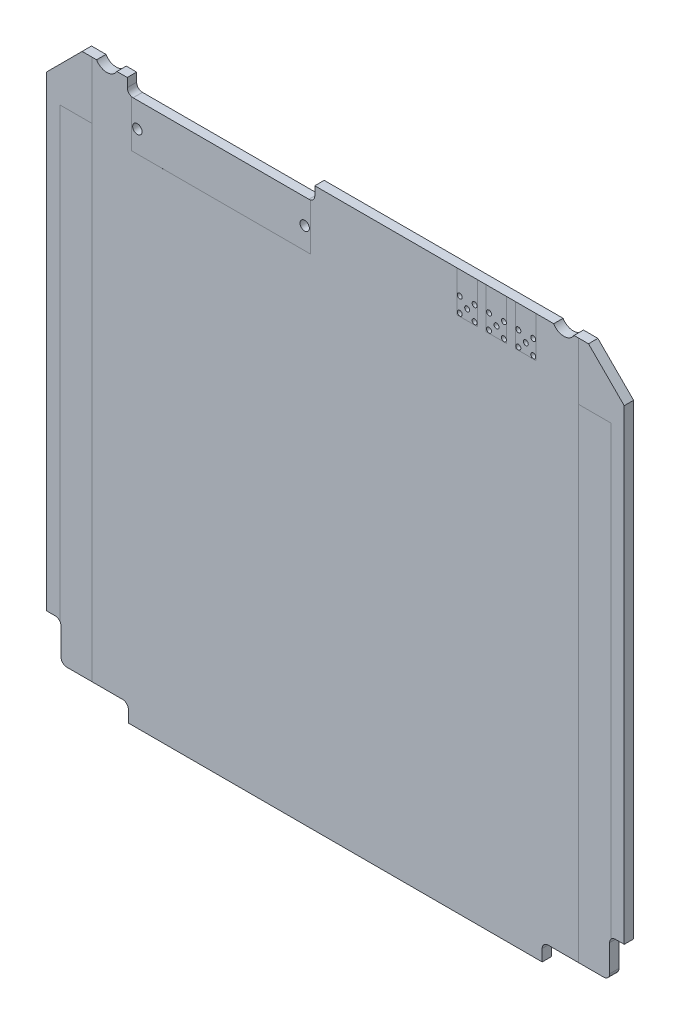
from build123d import *

# Parameters (mm, degrees)
SKETCH1_R               = 0.425
SKETCH1_R_2             = 0.8
BOSS_EXTRUDE1_DEPTH     = 1.6
KEEPOUT_TOP_DEPTH       = 0.0001
KEEPOUT_BOTTOM_DEPTH    = 0.0001
PARTFOOTPRINTS_W        = 30.48
PARTFOOTPRINTS_H        = 7.989227112
PARTFOOTPRINTS_W_2      = 3.5
PARTFOOTPRINTS_H_2      = 6.95
FOOTPRINTS_DEPTH        = 0.0001
CAUTION_TOP_START       = -0.00015
CAUTION_TOP_DEPTH       = 0.00015
CUT_EXTRUDE2_DEPTH      = 71.235674696
CUT_EXTRUDE2_DEPTH_BACK = 71.235674696


with BuildPart() as part:
    # Sketch1 → Boss-Extrude1 (new body)
    with BuildSketch(Plane(origin=(0, 0, -0.0125), x_dir=(-1, 0, 0), z_dir=(0, 0, -1))):
        with BuildLine():
            Line((35.3, -50), (35.3, -48))
            ThreePointArc((35.3, -48), (35.592893219, -47.292893219), (36.3, -47))
            Line((36.3, -47), (45.8, -47))
            ThreePointArc((45.8, -47), (46.507106781, -46.707106781), (46.8, -46))
            Line((46.8, -46), (46.8, -41.4))
            ThreePointArc((46.8, -41.4), (47.092893219, -40.692893219), (47.8, -40.4))
            Line((47.8, -40.4), (49.3, -40.4))
            Line((49.3, -40.4), (49.3, 39.2))
            Line((49.3, 39.2), (43.2, 45.3))
            Line((43.2, 45.3), (35.500000002, 45.3))
            Line((35.500000002, 45.3), (35.500000002, 43.8))
            ThreePointArc((35.500000002, 43.8), (35.207106783, 43.092893219), (34.500000002, 42.8))
            Line((34.500000002, 42.8), (4.499999998, 42.8))
            ThreePointArc((4.499999998, 42.8), (3.792893217, 43.092893219), (3.499999998, 43.8))
            Line((3.499999998, 43.8), (3.499999998, 45.3))
            Line((3.499999998, 45.3), (-43.2, 45.3))
            Line((-43.2, 45.3), (-49.3, 39.2))
            Line((-49.3, 39.2), (-49.3, -40.4))
            Line((-49.3, -40.4), (-47.8, -40.4))
            ThreePointArc((-47.8, -40.4), (-47.092893219, -40.692893219), (-46.8, -41.4))
            Line((-46.8, -41.4), (-46.8, -46))
            ThreePointArc((-46.8, -46), (-46.507106781, -46.707106781), (-45.8, -47))
            Line((-45.8, -47), (-36.3, -47))
            ThreePointArc((-36.3, -47), (-35.592893219, -47.292893219), (-35.3, -48))
            Line((-35.3, -48), (-35.3, -50))
            Line((-35.3, -50), (35.3, -50))
        make_face()
        with Locations((-26.23, 41.37)):
            Circle(SKETCH1_R, mode=Mode.SUBTRACT)
        with Locations((-28.77, 41.37)):
            Circle(SKETCH1_R, mode=Mode.SUBTRACT)
        with Locations((-27.5, 40.1)):
            Circle(SKETCH1_R, mode=Mode.SUBTRACT)
        with Locations((-21.23, 41.37)):
            Circle(SKETCH1_R, mode=Mode.SUBTRACT)
        with Locations((-28.77, 38.83)):
            Circle(SKETCH1_R, mode=Mode.SUBTRACT)
        with Locations((-23.77, 41.37)):
            Circle(SKETCH1_R, mode=Mode.SUBTRACT)
        with Locations((-22.5, 40.1)):
            Circle(SKETCH1_R, mode=Mode.SUBTRACT)
        with Locations((-26.23, 38.83)):
            Circle(SKETCH1_R, mode=Mode.SUBTRACT)
        with Locations((-31.23, 41.37)):
            Circle(SKETCH1_R, mode=Mode.SUBTRACT)
        with Locations((-33.77, 41.37)):
            Circle(SKETCH1_R, mode=Mode.SUBTRACT)
        with Locations((-23.77, 38.83)):
            Circle(SKETCH1_R, mode=Mode.SUBTRACT)
        with Locations((-32.5, 40.1)):
            Circle(SKETCH1_R, mode=Mode.SUBTRACT)
        with Locations((-33.77, 38.83)):
            Circle(SKETCH1_R, mode=Mode.SUBTRACT)
        with Locations((-31.23, 38.83)):
            Circle(SKETCH1_R, mode=Mode.SUBTRACT)
        with Locations((33.775, 38.54)):
            Circle(SKETCH1_R_2, mode=Mode.SUBTRACT)
        with Locations((5.225, 38.54)):
            Circle(SKETCH1_R_2, mode=Mode.SUBTRACT)
        with Locations((-21.23, 38.83)):
            Circle(SKETCH1_R, mode=Mode.SUBTRACT)
    extrude(amount=-BOSS_EXTRUDE1_DEPTH)

    # thermalContacts_lower → keepOut_top (cut)
    with BuildSketch(Plane(origin=(0, 0, -0.0125), x_dir=(-1, 0, 0), z_dir=(0, 0, -1))):
        Polygon((47, 35.5), (47, -41.5), (59.827263463, -41.5), (59.827263463, 47), (41.5, 47), (41.5, 41.5), (41.5, 35.5), align=None)
        Polygon((-47, 35.5), (-47, -41.172629575), (-54.178242861, -41.172629575), (-54.178242861, 47.858281552), (-41.5, 47.858281552), (-41.5, 42.552215379), (-41.5, 35.5), align=None)
    extrude(amount=-KEEPOUT_TOP_DEPTH, mode=Mode.SUBTRACT)

    # thermalContacts_upper → keepOut_bottom (cut)
    with BuildSketch(Plane.XY.offset(1.5875)):
        Polygon((-47, 35.5), (-47, -41.5), (-56.192158269, -41.5), (-56.192158269, 47), (-41.5, 47), (-41.5, 41.5), (-41.5, 35.5), align=None)
        Polygon((47, 35.5), (47, -41.5), (59.827263463, -41.5), (59.827263463, 47), (41.5, 47), (41.5, 41.5), (41.5, 35.5), align=None)
    extrude(amount=-KEEPOUT_BOTTOM_DEPTH, mode=Mode.SUBTRACT)

    # partFootprints → footPrints (cut)
    with BuildSketch(Plane.XY.offset(1.5875)):
        with Locations((-19.5, 38.834613556)):
            Rectangle(PARTFOOTPRINTS_W, PARTFOOTPRINTS_H)
        with Locations((22.5, 41.825)):
            Rectangle(PARTFOOTPRINTS_W_2, PARTFOOTPRINTS_H_2)
        with Locations((27.5, 41.825)):
            Rectangle(PARTFOOTPRINTS_W_2, PARTFOOTPRINTS_H_2)
        with Locations((32.5, 41.825)):
            Rectangle(PARTFOOTPRINTS_W_2, PARTFOOTPRINTS_H_2)
    extrude(amount=-FOOTPRINTS_DEPTH, mode=Mode.SUBTRACT)

    # Sketch3 → caution_top (cut)
    with BuildSketch(Plane.XY.offset(1.5875).offset(CAUTION_TOP_START)):
        with BuildLine():
            Line((41.5, -47), (41.5, 35.5))
            Line((41.5, 35.5), (47, 35.5))
            Line((47, 35.5), (47, -40.8))
            ThreePointArc((47, -40.8), (46.851316702, -41.083772234), (46.8, -41.4))
            Line((46.8, -41.4), (46.8, -46))
            ThreePointArc((46.8, -46), (46.507106781, -46.707106781), (45.8, -47))
            Line((45.8, -47), (41.5, -47))
        make_face()
        with BuildLine():
            Line((-41.5, 35.5), (-47, 35.5))
            Line((-47, 35.5), (-47, -40.8))
            ThreePointArc((-47, -40.8), (-46.851316702, -41.083772234), (-46.8, -41.4))
            Line((-46.8, -41.4), (-46.8, -46))
            ThreePointArc((-46.8, -46), (-46.507106781, -46.707106781), (-45.8, -47))
            Line((-45.8, -47), (-41.5, -47))
            Line((-41.5, -47), (-41.5, 35.5))
        make_face()
    caution_top = extrude(amount=CAUTION_TOP_DEPTH, mode=Mode.SUBTRACT)

    # caution_bottom: caution_top across plane
    add(caution_top.mirror(Plane.XY.offset(0.7875)), mode=Mode.SUBTRACT)

    # Sketch4 → Cut-Extrude2 (cut, two sides: drawn at the far end of the back side and taken through both)
    with BuildSketch(Plane.XY.offset(1.5875).offset(-CUT_EXTRUDE2_DEPTH_BACK)):
        with BuildLine():
            Line((37.267949192, 45.3), (40.732050808, 45.3))
            ThreePointArc((40.732050808, 45.3), (39, 44.3), (37.267949192, 45.3))
        make_face()
        with BuildLine():
            Line((-37.267949192, 45.3), (-40.732050808, 45.3))
            ThreePointArc((-40.732050808, 45.3), (-39, 44.3), (-37.267949192, 45.3))
        make_face()
    extrude(amount=CUT_EXTRUDE2_DEPTH + CUT_EXTRUDE2_DEPTH_BACK, mode=Mode.SUBTRACT)


solid = part.part
